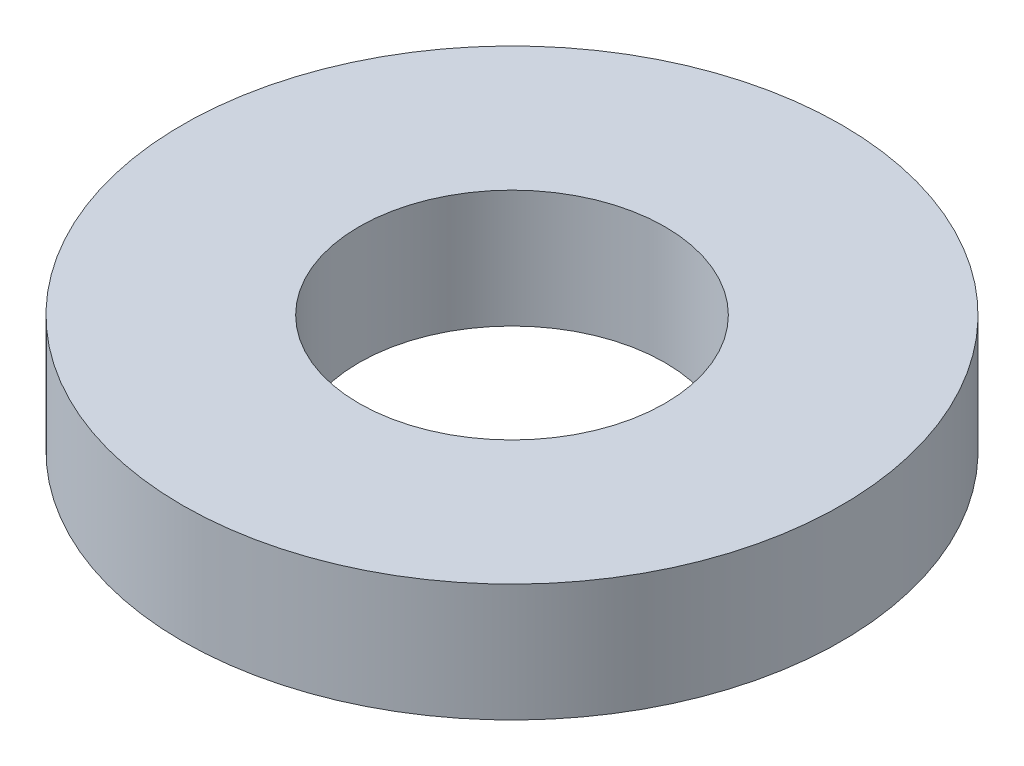
from build123d import *

# Parameters (mm, degrees)
SKETCH1_R           = 70
BOSS_EXTRUDE1_DEPTH = 25
SKETCH2_R           = 32.5
CUT_EXTRUDE1_DEPTH  = 103.102889283


with BuildPart() as part:
    # Sketch1 → Boss-Extrude1 (new body)
    with BuildSketch(Plane(origin=(0, 0, 0), x_dir=(1, 0, 0), z_dir=(0, 1, 0))):
        Circle(SKETCH1_R)
    extrude(amount=BOSS_EXTRUDE1_DEPTH)

    # Sketch2 → Cut-Extrude1 (cut, through all)
    with BuildSketch(Plane(origin=(0, 0, 0), x_dir=(1, 0, 0), z_dir=(0, 1, 0))):
        Circle(SKETCH2_R)
    extrude(amount=CUT_EXTRUDE1_DEPTH, mode=Mode.SUBTRACT)


solid = part.part
